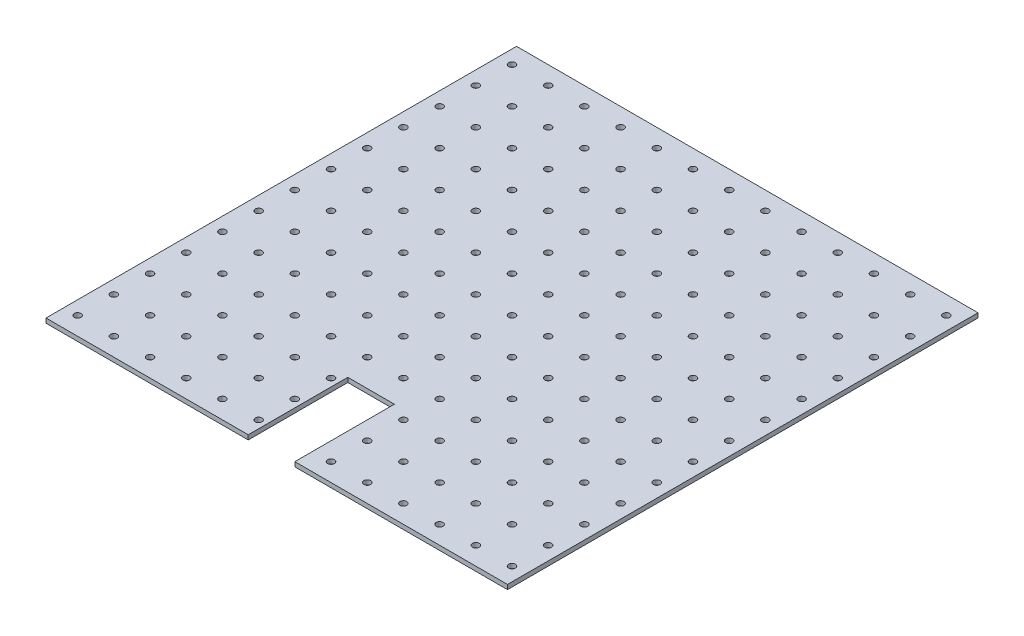
from build123d import *

# Parameters (mm, degrees)
SKETCH2_W               = 323.85
SKETCH2_H               = 330.2
BOSS_EXTRUDE2_DEPTH     = 1.5875
CUT_EXTRUDE1_START      = -1.5875
CUT_EXTRUDE1_OUTLINE_R  = 2.38125
CUT_EXTRUDE1_DEPTH      = 3.175
CUT_EXTRUDE2_DEPTH      = 232.257942093
CUT_EXTRUDE2_DEPTH_BACK = 232.257942093


with BuildPart() as part:
    # Sketch2 → Boss-Extrude2 (new, symmetric)
    with BuildSketch(Plane(origin=(0, 0, 0), x_dir=(1, 0, 0), z_dir=(0, 1, 0))):
        Rectangle(SKETCH2_W, SKETCH2_H)
    extrude(amount=BOSS_EXTRUDE2_DEPTH, both=True)

    # Cut-Extrude1: read off the stored shape, not the designer's step
    # Cut-Extrude1 outline → Cut-Extrude1 (cut)
    with BuildSketch(Plane(origin=(0, 0, 0), x_dir=(1, 0, 0), z_dir=(0, 1, 0)).offset(CUT_EXTRUDE1_START)):
        Circle(CUT_EXTRUDE1_OUTLINE_R)
        with Locations((-127, 152.4)):
            Circle(CUT_EXTRUDE1_OUTLINE_R)
        with Locations((-127, 127)):
            Circle(CUT_EXTRUDE1_OUTLINE_R)
        with Locations((-127, 101.6)):
            Circle(CUT_EXTRUDE1_OUTLINE_R)
        with Locations((-127, 76.2)):
            Circle(CUT_EXTRUDE1_OUTLINE_R)
        with Locations((-127, 50.8)):
            Circle(CUT_EXTRUDE1_OUTLINE_R)
        with Locations((-101.6, 127)):
            Circle(CUT_EXTRUDE1_OUTLINE_R)
        with Locations((-101.6, 152.4)):
            Circle(CUT_EXTRUDE1_OUTLINE_R)
        with Locations((-127, 25.4)):
            Circle(CUT_EXTRUDE1_OUTLINE_R)
        with Locations((-152.4, 152.4)):
            Circle(CUT_EXTRUDE1_OUTLINE_R)
        with Locations((-152.4, 127)):
            Circle(CUT_EXTRUDE1_OUTLINE_R)
        with Locations((-152.4, 101.6)):
            Circle(CUT_EXTRUDE1_OUTLINE_R)
        with Locations((-152.4, 76.2)):
            Circle(CUT_EXTRUDE1_OUTLINE_R)
        with Locations((-152.4, 50.8)):
            Circle(CUT_EXTRUDE1_OUTLINE_R)
        with Locations((-152.4, 25.4)):
            Circle(CUT_EXTRUDE1_OUTLINE_R)
        with Locations((-50.8, 50.8)):
            Circle(CUT_EXTRUDE1_OUTLINE_R)
        with Locations((-50.8, 25.4)):
            Circle(CUT_EXTRUDE1_OUTLINE_R)
        with Locations((-50.8, 76.2)):
            Circle(CUT_EXTRUDE1_OUTLINE_R)
        with Locations((-50.8, 101.6)):
            Circle(CUT_EXTRUDE1_OUTLINE_R)
        with Locations((-50.8, 127)):
            Circle(CUT_EXTRUDE1_OUTLINE_R)
        with Locations((-50.8, 152.4)):
            Circle(CUT_EXTRUDE1_OUTLINE_R)
        with Locations((-25.4, 127)):
            Circle(CUT_EXTRUDE1_OUTLINE_R)
        with Locations((-25.4, 101.6)):
            Circle(CUT_EXTRUDE1_OUTLINE_R)
        with Locations((-25.4, 76.2)):
            Circle(CUT_EXTRUDE1_OUTLINE_R)
        with Locations((-25.4, 50.8)):
            Circle(CUT_EXTRUDE1_OUTLINE_R)
        with Locations((-25.4, 25.4)):
            Circle(CUT_EXTRUDE1_OUTLINE_R)
        with Locations((-25.4, 152.4)):
            Circle(CUT_EXTRUDE1_OUTLINE_R)
        with Locations((-101.6, 25.4)):
            Circle(CUT_EXTRUDE1_OUTLINE_R)
        with Locations((-101.6, 50.8)):
            Circle(CUT_EXTRUDE1_OUTLINE_R)
        with Locations((-101.6, 76.2)):
            Circle(CUT_EXTRUDE1_OUTLINE_R)
        with Locations((-101.6, 101.6)):
            Circle(CUT_EXTRUDE1_OUTLINE_R)
        with Locations((-76.2, 152.4)):
            Circle(CUT_EXTRUDE1_OUTLINE_R)
        with Locations((-76.2, 127)):
            Circle(CUT_EXTRUDE1_OUTLINE_R)
        with Locations((-76.2, 101.6)):
            Circle(CUT_EXTRUDE1_OUTLINE_R)
        with Locations((-76.2, 25.4)):
            Circle(CUT_EXTRUDE1_OUTLINE_R)
        with Locations((-76.2, 50.8)):
            Circle(CUT_EXTRUDE1_OUTLINE_R)
        with Locations((-76.2, 76.2)):
            Circle(CUT_EXTRUDE1_OUTLINE_R)
        with Locations((0, 25.4)):
            Circle(CUT_EXTRUDE1_OUTLINE_R)
        with Locations((0, 50.8)):
            Circle(CUT_EXTRUDE1_OUTLINE_R)
        with Locations((0, 76.2)):
            Circle(CUT_EXTRUDE1_OUTLINE_R)
        with Locations((0, 101.6)):
            Circle(CUT_EXTRUDE1_OUTLINE_R)
        with Locations((101.6, -25.4)):
            Circle(CUT_EXTRUDE1_OUTLINE_R)
        with Locations((101.6, -50.8)):
            Circle(CUT_EXTRUDE1_OUTLINE_R)
        with Locations((101.6, -76.2)):
            Circle(CUT_EXTRUDE1_OUTLINE_R)
        with Locations((101.6, -101.6)):
            Circle(CUT_EXTRUDE1_OUTLINE_R)
        with Locations((76.2, -152.4)):
            Circle(CUT_EXTRUDE1_OUTLINE_R)
        with Locations((76.2, -127)):
            Circle(CUT_EXTRUDE1_OUTLINE_R)
        with Locations((76.2, -101.6)):
            Circle(CUT_EXTRUDE1_OUTLINE_R)
        with Locations((76.2, -25.4)):
            Circle(CUT_EXTRUDE1_OUTLINE_R)
        with Locations((76.2, -50.8)):
            Circle(CUT_EXTRUDE1_OUTLINE_R)
        with Locations((76.2, -76.2)):
            Circle(CUT_EXTRUDE1_OUTLINE_R)
        with Locations((127, -152.4)):
            Circle(CUT_EXTRUDE1_OUTLINE_R)
        with Locations((127, -127)):
            Circle(CUT_EXTRUDE1_OUTLINE_R)
        with Locations((127, -101.6)):
            Circle(CUT_EXTRUDE1_OUTLINE_R)
        with Locations((127, -76.2)):
            Circle(CUT_EXTRUDE1_OUTLINE_R)
        with Locations((127, -50.8)):
            Circle(CUT_EXTRUDE1_OUTLINE_R)
        with Locations((101.6, -127)):
            Circle(CUT_EXTRUDE1_OUTLINE_R)
        with Locations((101.6, -152.4)):
            Circle(CUT_EXTRUDE1_OUTLINE_R)
        with Locations((127, -25.4)):
            Circle(CUT_EXTRUDE1_OUTLINE_R)
        with Locations((0, 152.4)):
            Circle(CUT_EXTRUDE1_OUTLINE_R)
        with Locations((0, 127)):
            Circle(CUT_EXTRUDE1_OUTLINE_R)
        with Locations((0, -25.4)):
            Circle(CUT_EXTRUDE1_OUTLINE_R)
        with Locations((0, -50.8)):
            Circle(CUT_EXTRUDE1_OUTLINE_R)
        with Locations((0, -76.2)):
            Circle(CUT_EXTRUDE1_OUTLINE_R)
        with Locations((0, -101.6)):
            Circle(CUT_EXTRUDE1_OUTLINE_R)
        with Locations((0, -127)):
            Circle(CUT_EXTRUDE1_OUTLINE_R)
        with Locations((0, -152.4)):
            Circle(CUT_EXTRUDE1_OUTLINE_R)
        with Locations((50.8, -50.8)):
            Circle(CUT_EXTRUDE1_OUTLINE_R)
        with Locations((50.8, -25.4)):
            Circle(CUT_EXTRUDE1_OUTLINE_R)
        with Locations((50.8, -76.2)):
            Circle(CUT_EXTRUDE1_OUTLINE_R)
        with Locations((50.8, -101.6)):
            Circle(CUT_EXTRUDE1_OUTLINE_R)
        with Locations((50.8, -127)):
            Circle(CUT_EXTRUDE1_OUTLINE_R)
        with Locations((50.8, -152.4)):
            Circle(CUT_EXTRUDE1_OUTLINE_R)
        with Locations((25.4, -127)):
            Circle(CUT_EXTRUDE1_OUTLINE_R)
        with Locations((25.4, -101.6)):
            Circle(CUT_EXTRUDE1_OUTLINE_R)
        with Locations((25.4, -76.2)):
            Circle(CUT_EXTRUDE1_OUTLINE_R)
        with Locations((25.4, -50.8)):
            Circle(CUT_EXTRUDE1_OUTLINE_R)
        with Locations((25.4, -25.4)):
            Circle(CUT_EXTRUDE1_OUTLINE_R)
        with Locations((25.4, -152.4)):
            Circle(CUT_EXTRUDE1_OUTLINE_R)
        with Locations((127, 101.6)):
            Circle(CUT_EXTRUDE1_OUTLINE_R)
        with Locations((152.4, 101.6)):
            Circle(CUT_EXTRUDE1_OUTLINE_R)
        with Locations((25.4, 127)):
            Circle(CUT_EXTRUDE1_OUTLINE_R)
        with Locations((25.4, 101.6)):
            Circle(CUT_EXTRUDE1_OUTLINE_R)
        with Locations((50.8, 101.6)):
            Circle(CUT_EXTRUDE1_OUTLINE_R)
        with Locations((76.2, 101.6)):
            Circle(CUT_EXTRUDE1_OUTLINE_R)
        with Locations((101.6, 101.6)):
            Circle(CUT_EXTRUDE1_OUTLINE_R)
        with Locations((152.4, 152.4)):
            Circle(CUT_EXTRUDE1_OUTLINE_R)
        with Locations((127, 152.4)):
            Circle(CUT_EXTRUDE1_OUTLINE_R)
        with Locations((101.6, 152.4)):
            Circle(CUT_EXTRUDE1_OUTLINE_R)
        with Locations((76.2, 152.4)):
            Circle(CUT_EXTRUDE1_OUTLINE_R)
        with Locations((50.8, 152.4)):
            Circle(CUT_EXTRUDE1_OUTLINE_R)
        with Locations((25.4, 152.4)):
            Circle(CUT_EXTRUDE1_OUTLINE_R)
        with Locations((152.4, 127)):
            Circle(CUT_EXTRUDE1_OUTLINE_R)
        with Locations((127, 127)):
            Circle(CUT_EXTRUDE1_OUTLINE_R)
        with Locations((101.6, 127)):
            Circle(CUT_EXTRUDE1_OUTLINE_R)
        with Locations((76.2, 127)):
            Circle(CUT_EXTRUDE1_OUTLINE_R)
        with Locations((50.8, 127)):
            Circle(CUT_EXTRUDE1_OUTLINE_R)
        with Locations((127, 25.4)):
            Circle(CUT_EXTRUDE1_OUTLINE_R)
        with Locations((101.6, 25.4)):
            Circle(CUT_EXTRUDE1_OUTLINE_R)
        with Locations((76.2, 25.4)):
            Circle(CUT_EXTRUDE1_OUTLINE_R)
        with Locations((50.8, 25.4)):
            Circle(CUT_EXTRUDE1_OUTLINE_R)
        with Locations((25.4, 25.4)):
            Circle(CUT_EXTRUDE1_OUTLINE_R)
        with Locations((152.4, 25.4)):
            Circle(CUT_EXTRUDE1_OUTLINE_R)
        with Locations((152.4, 0)):
            Circle(CUT_EXTRUDE1_OUTLINE_R)
        with Locations((127, 0)):
            Circle(CUT_EXTRUDE1_OUTLINE_R)
        with Locations((101.6, 0)):
            Circle(CUT_EXTRUDE1_OUTLINE_R)
        with Locations((76.2, 0)):
            Circle(CUT_EXTRUDE1_OUTLINE_R)
        with Locations((50.8, 0)):
            Circle(CUT_EXTRUDE1_OUTLINE_R)
        with Locations((25.4, 0)):
            Circle(CUT_EXTRUDE1_OUTLINE_R)
        with Locations((152.4, 76.2)):
            Circle(CUT_EXTRUDE1_OUTLINE_R)
        with Locations((127, 76.2)):
            Circle(CUT_EXTRUDE1_OUTLINE_R)
        with Locations((101.6, 76.2)):
            Circle(CUT_EXTRUDE1_OUTLINE_R)
        with Locations((25.4, 76.2)):
            Circle(CUT_EXTRUDE1_OUTLINE_R)
        with Locations((50.8, 76.2)):
            Circle(CUT_EXTRUDE1_OUTLINE_R)
        with Locations((76.2, 76.2)):
            Circle(CUT_EXTRUDE1_OUTLINE_R)
        with Locations((50.8, 50.8)):
            Circle(CUT_EXTRUDE1_OUTLINE_R)
        with Locations((25.4, 50.8)):
            Circle(CUT_EXTRUDE1_OUTLINE_R)
        with Locations((76.2, 50.8)):
            Circle(CUT_EXTRUDE1_OUTLINE_R)
        with Locations((101.6, 50.8)):
            Circle(CUT_EXTRUDE1_OUTLINE_R)
        with Locations((127, 50.8)):
            Circle(CUT_EXTRUDE1_OUTLINE_R)
        with Locations((152.4, 50.8)):
            Circle(CUT_EXTRUDE1_OUTLINE_R)
        with Locations((-152.4, -76.2)):
            Circle(CUT_EXTRUDE1_OUTLINE_R)
        with Locations((-127, -76.2)):
            Circle(CUT_EXTRUDE1_OUTLINE_R)
        with Locations((-101.6, -76.2)):
            Circle(CUT_EXTRUDE1_OUTLINE_R)
        with Locations((-25.4, -76.2)):
            Circle(CUT_EXTRUDE1_OUTLINE_R)
        with Locations((-50.8, -76.2)):
            Circle(CUT_EXTRUDE1_OUTLINE_R)
        with Locations((-76.2, -76.2)):
            Circle(CUT_EXTRUDE1_OUTLINE_R)
        with Locations((-50.8, -50.8)):
            Circle(CUT_EXTRUDE1_OUTLINE_R)
        with Locations((-25.4, -50.8)):
            Circle(CUT_EXTRUDE1_OUTLINE_R)
        with Locations((-76.2, -50.8)):
            Circle(CUT_EXTRUDE1_OUTLINE_R)
        with Locations((-101.6, -50.8)):
            Circle(CUT_EXTRUDE1_OUTLINE_R)
        with Locations((-127, -50.8)):
            Circle(CUT_EXTRUDE1_OUTLINE_R)
        with Locations((-152.4, -50.8)):
            Circle(CUT_EXTRUDE1_OUTLINE_R)
        with Locations((-127, -101.6)):
            Circle(CUT_EXTRUDE1_OUTLINE_R)
        with Locations((-152.4, -101.6)):
            Circle(CUT_EXTRUDE1_OUTLINE_R)
        with Locations((-25.4, -127)):
            Circle(CUT_EXTRUDE1_OUTLINE_R)
        with Locations((-25.4, -101.6)):
            Circle(CUT_EXTRUDE1_OUTLINE_R)
        with Locations((-50.8, -101.6)):
            Circle(CUT_EXTRUDE1_OUTLINE_R)
        with Locations((-76.2, -101.6)):
            Circle(CUT_EXTRUDE1_OUTLINE_R)
        with Locations((-101.6, -101.6)):
            Circle(CUT_EXTRUDE1_OUTLINE_R)
        with Locations((-25.4, 0)):
            Circle(CUT_EXTRUDE1_OUTLINE_R)
        with Locations((-50.8, 0)):
            Circle(CUT_EXTRUDE1_OUTLINE_R)
        with Locations((-76.2, 0)):
            Circle(CUT_EXTRUDE1_OUTLINE_R)
        with Locations((-101.6, 0)):
            Circle(CUT_EXTRUDE1_OUTLINE_R)
        with Locations((-127, 0)):
            Circle(CUT_EXTRUDE1_OUTLINE_R)
        with Locations((-152.4, 0)):
            Circle(CUT_EXTRUDE1_OUTLINE_R)
        with Locations((-152.4, -25.4)):
            Circle(CUT_EXTRUDE1_OUTLINE_R)
        with Locations((-25.4, -25.4)):
            Circle(CUT_EXTRUDE1_OUTLINE_R)
        with Locations((-50.8, -25.4)):
            Circle(CUT_EXTRUDE1_OUTLINE_R)
        with Locations((-76.2, -25.4)):
            Circle(CUT_EXTRUDE1_OUTLINE_R)
        with Locations((-101.6, -25.4)):
            Circle(CUT_EXTRUDE1_OUTLINE_R)
        with Locations((-127, -25.4)):
            Circle(CUT_EXTRUDE1_OUTLINE_R)
        with Locations((-152.4, -152.4)):
            Circle(CUT_EXTRUDE1_OUTLINE_R)
        with Locations((-127, -152.4)):
            Circle(CUT_EXTRUDE1_OUTLINE_R)
        with Locations((-101.6, -152.4)):
            Circle(CUT_EXTRUDE1_OUTLINE_R)
        with Locations((-76.2, -152.4)):
            Circle(CUT_EXTRUDE1_OUTLINE_R)
        with Locations((-50.8, -152.4)):
            Circle(CUT_EXTRUDE1_OUTLINE_R)
        with Locations((-25.4, -152.4)):
            Circle(CUT_EXTRUDE1_OUTLINE_R)
        with Locations((-152.4, -127)):
            Circle(CUT_EXTRUDE1_OUTLINE_R)
        with Locations((-127, -127)):
            Circle(CUT_EXTRUDE1_OUTLINE_R)
        with Locations((-101.6, -127)):
            Circle(CUT_EXTRUDE1_OUTLINE_R)
        with Locations((-76.2, -127)):
            Circle(CUT_EXTRUDE1_OUTLINE_R)
        with Locations((-50.8, -127)):
            Circle(CUT_EXTRUDE1_OUTLINE_R)
        with Locations((152.4, -152.4)):
            Circle(CUT_EXTRUDE1_OUTLINE_R)
        with Locations((152.4, -127)):
            Circle(CUT_EXTRUDE1_OUTLINE_R)
        with Locations((152.4, -101.6)):
            Circle(CUT_EXTRUDE1_OUTLINE_R)
        with Locations((152.4, -76.2)):
            Circle(CUT_EXTRUDE1_OUTLINE_R)
        with Locations((152.4, -50.8)):
            Circle(CUT_EXTRUDE1_OUTLINE_R)
        with Locations((152.4, -25.4)):
            Circle(CUT_EXTRUDE1_OUTLINE_R)
    extrude(amount=CUT_EXTRUDE1_DEPTH, mode=Mode.SUBTRACT)

    # Sketch5 → Cut-Extrude2 (cut, two sides: drawn at the far end of the back side and taken through both)
    with BuildSketch(Plane(origin=(0, 0, 0), x_dir=(1, 0, 0), z_dir=(0, 1, 0)).offset(-CUT_EXTRUDE2_DEPTH_BACK)):
        Polygon((0, -165.1), (12.7, -165.1), (12.7, -95.25), (0, -95.25), (-20, -95.25), (-20, -165.1), align=None)
    extrude(amount=CUT_EXTRUDE2_DEPTH + CUT_EXTRUDE2_DEPTH_BACK, mode=Mode.SUBTRACT)


solid = part.part
